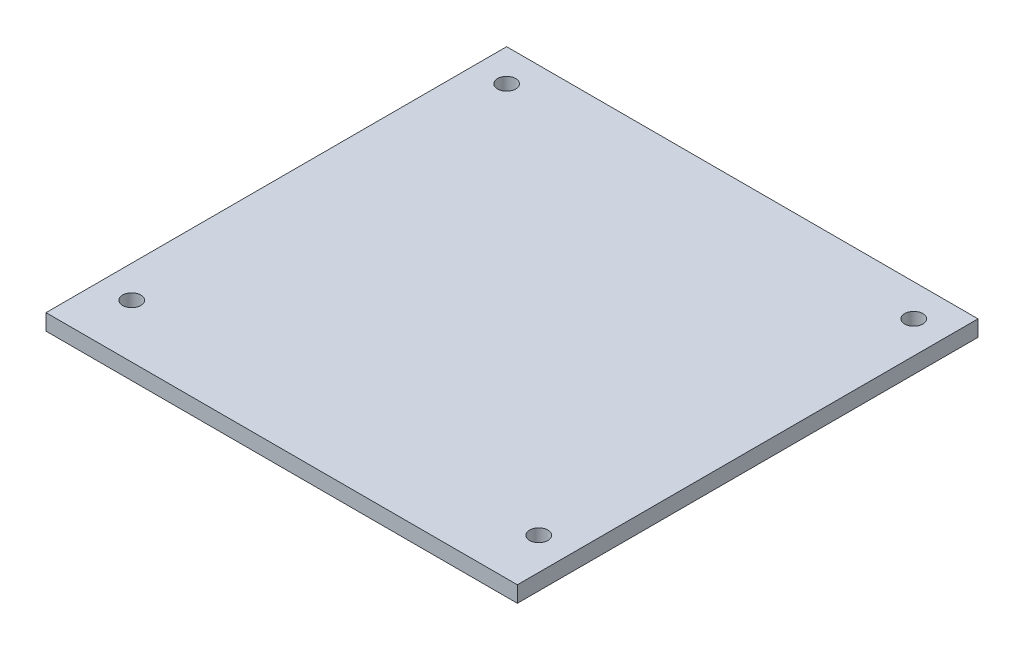
from build123d import *

# Parameters (mm, degrees)
SKETCH1_W           = 88
SKETCH1_H           = 82
BOSS_EXTRUDE1_DEPTH = 3
SKETCH2_R           = 1.7
CUT_EXTRUDE1_DEPTH  = 61.216276869
SKETCH4_W           = 81.2
SKETCH4_H           = 75.2
SKETCH4_W_2         = 75.2
SKETCH4_H_2         = 69.2
BOSS_EXTRUDE2_DEPTH = 2
CUT_EXTRUDE5_START  = -3
SKETCH6_R           = 6
CUT_EXTRUDE5_DEPTH  = 58.348985078
SKETCH7_W           = 88
SKETCH7_H           = 3
BOSS_EXTRUDE3_DEPTH = 4


with BuildPart() as part:
    # Sketch1 → Boss-Extrude1 (new body)
    with BuildSketch(Plane(origin=(0, 0, 0), x_dir=(1, 0, 0), z_dir=(0, 1, 0))):
        Rectangle(SKETCH1_W, SKETCH1_H)
    extrude(amount=BOSS_EXTRUDE1_DEPTH)

    # Sketch2 → Cut-Extrude1 (cut, through all)
    with BuildSketch(Plane(origin=(0, 3, 0), x_dir=(1, 0, 0), z_dir=(0, 1, 0))):
        with Locations((-38, 35)):
            Circle(SKETCH2_R)
        with Locations((38, 35)):
            Circle(SKETCH2_R)
        with Locations((38, -35)):
            Circle(SKETCH2_R)
        with Locations((-38, -35)):
            Circle(SKETCH2_R)
    extrude(amount=-CUT_EXTRUDE1_DEPTH, mode=Mode.SUBTRACT)

    # Sketch4 → Boss-Extrude2 (add)
    with BuildSketch(Plane.XZ):
        Rectangle(SKETCH4_W, SKETCH4_H)
        Rectangle(SKETCH4_W_2, SKETCH4_H_2, mode=Mode.SUBTRACT)
    extrude(amount=BOSS_EXTRUDE2_DEPTH)

    # Sketch6 → Cut-Extrude5 (cut, through all)
    with BuildSketch(Plane(origin=(0, 3, 0), x_dir=(1, 0, 0), z_dir=(0, 1, 0)).offset(CUT_EXTRUDE5_START)):
        with Locations((-38, 35)):
            Circle(SKETCH6_R)
        with Locations((-38, -35)):
            Circle(SKETCH6_R)
        with Locations((38, -35)):
            Circle(SKETCH6_R)
        with Locations((38, 35)):
            Circle(SKETCH6_R)
    extrude(amount=-CUT_EXTRUDE5_DEPTH, mode=Mode.SUBTRACT)

    # Sketch7 → Boss-Extrude3 (add)
    with BuildSketch(Plane.XY.offset(41)):
        with Locations((0, 1.5)):
            Rectangle(SKETCH7_W, SKETCH7_H)
    extrude(amount=BOSS_EXTRUDE3_DEPTH)


solid = part.part
